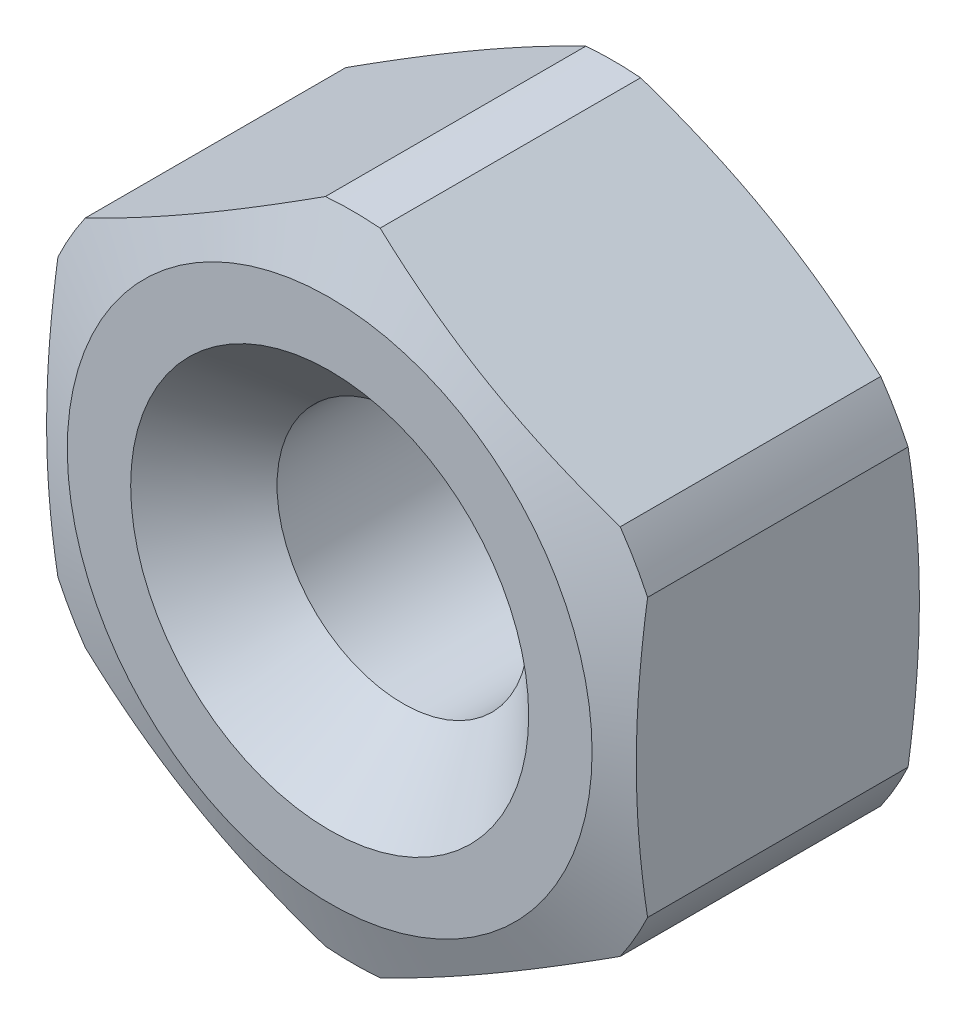
from build123d import *

# Parameters (mm, degrees)
SKETCH_2_OUTSIDE_W  = 16.344
SKETCH_2_OUTSIDE_H  = 16.344
CUT_EXTRUDE_1_DEPTH = 10.385693901


with BuildPart() as part:
    # Эскиз1 → Повернуть1 (revolve)
    with BuildSketch(Plane(origin=(0, 0, 0), x_dir=(0, 0, -1), z_dir=(1, 0, 0))):
        Polygon((-1.358974596, 2.133974596), (1.358974596, 2.133974596), (2.6, 3.375), (2.6, 4.45), (2.208731998, 5.525), (-2.208731998, 5.525), (-2.6, 4.45), (-2.6, 3.375), align=None)
    revolve(axis=Axis((0, 0, 152.740188543), (0, 0, -1)))

    # Эскиз2 outside → Вырез-Вытянуть1 (cut, through all)
    with BuildSketch(Plane.XY.offset(2.6)):
        Rectangle(SKETCH_2_OUTSIDE_W, SKETCH_2_OUTSIDE_H)
        Polygon((0, -5.773502692), (5, -2.886751346), (5, 2.886751346), (0, 5.773502692), (-5, 2.886751346), (-5, -2.886751346), align=None, mode=Mode.SUBTRACT)
    extrude(amount=-CUT_EXTRUDE_1_DEPTH, mode=Mode.SUBTRACT)


solid = part.part
